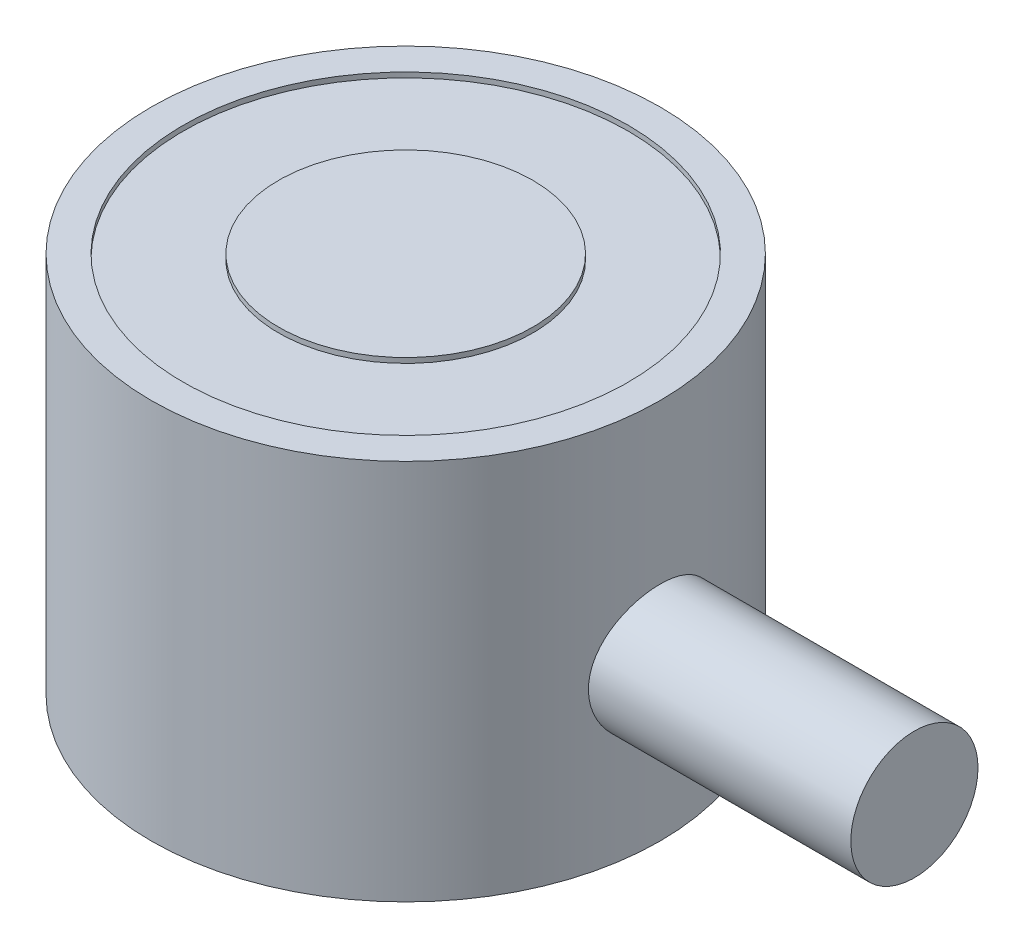
from build123d import *

# Parameters (mm, degrees)
SKETCH1_R           = 12.7
BOSS_EXTRUDE1_DEPTH = 19.05
SKETCH2_W           = 4.7625
SKETCH2_H           = 0.254
SKETCH3_R           = 2.413
CUT_EXTRUDE1_DEPTH  = 9.525
BOSS_EXTRUDE2_START = 25.4
SKETCH7_R           = 3.175
BOSS_EXTRUDE2_DEPTH = 13.103277876


# Read off the part's stored shape, not the designer's step: Cut-Extrude2
with BuildPart() as part:
    # Sketch1 → Boss-Extrude1 (new body)
    with BuildSketch(Plane(origin=(0, 0, 0), x_dir=(1, 0, 0), z_dir=(0, 1, 0))):
        with Locations(Location((0, 0, 0), (0, 0, 90))):
            Circle(SKETCH1_R)
    extrude(amount=BOSS_EXTRUDE1_DEPTH)

    # Sketch2 → Cut-Revolve1 (revolve, cut)
    with BuildSketch(Plane.XY, mode=Mode.PRIVATE) as cut_revolve1_sk:
        with Locations((-8.73125, 18.923)):
            Rectangle(SKETCH2_W, SKETCH2_H)
    revolve(cut_revolve1_sk.sketch.rotate(Axis((0, 0, 0), (0, 1, 0)), 270), axis=Axis((0, 0, 0), (0, 1, 0)), mode=Mode.SUBTRACT)

    # Sketch3 → Cut-Extrude1 (cut)
    with BuildSketch(Plane.XZ):
        with Locations(Location((0, 0, 0), (0, 0, 270))):
            Circle(SKETCH3_R)
    extrude(amount=-CUT_EXTRUDE1_DEPTH, mode=Mode.SUBTRACT)

    # Cut-Extrude2 outline → Cut-Extrude2 (revolve, cut)
    with BuildSketch(Plane.XY):
        Polygon((2.498925958, 0), (2.413, 0.085925958), (2.413, 0), align=None)
    revolve(axis=Axis((0, 0, 0), (0, 1, 0)), mode=Mode.SUBTRACT)

    # Sketch7 → Boss-Extrude2 (add)
    with BuildSketch(Plane(origin=(0, 0, 0), x_dir=(0, 0, -1), z_dir=(1, 0, 0)).offset(BOSS_EXTRUDE2_START)):
        with Locations((0, 7.9375)):
            Circle(SKETCH7_R)
    extrude(amount=-BOSS_EXTRUDE2_DEPTH)


solid = part.part
